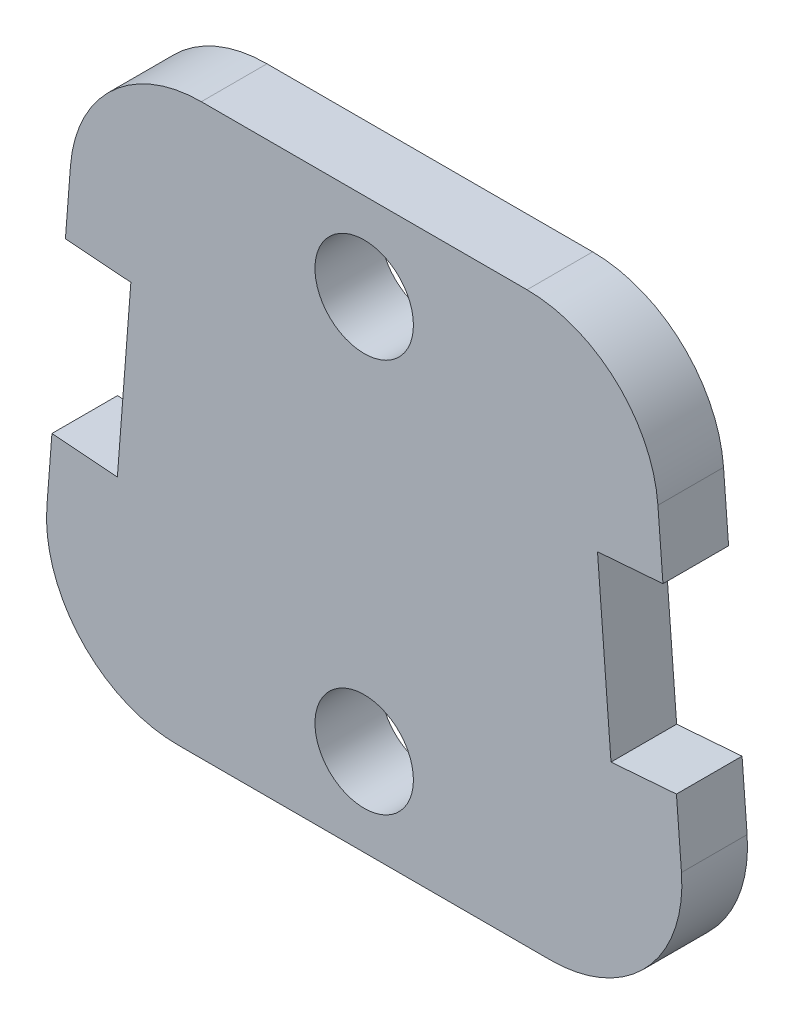
from build123d import *

# Parameters (mm, degrees)
BOSS_EXTRUDE1_DEPTH = 3.175
CAVITY1_DEPTH       = 3.175


# Read off the part's stored shape, not the designer's step: Cavity1
with BuildPart() as part:
    # Sketch1 → Boss-Extrude1 (new body)
    with BuildSketch(Plane.XY):
        with BuildLine():
            Line((-9.017779189, 0), (0, 0))
            Line((0, 0), (0, 1.852083291))
            ThreePointArc((0, 1.852083291), (-2.38125, 4.233333291), (0, 6.614583291))
            Line((0, 6.614583291), (0, 20.902083291))
            ThreePointArc((0, 20.902083291), (-2.38125, 23.283333291), (0, 25.664583291))
            Line((0, 25.664583291), (0, 27.516666667))
            Line((0, 27.516666667), (-7.878035599, 27.516666667))
            ThreePointArc((-7.878035599, 27.516666667), (-12.19254052, 25.825802562), (-14.209331582, 21.653689435))
            Line((-14.209331582, 21.653689435), (-15.349075172, 6.837022768))
            ThreePointArc((-15.349075172, 6.837022768), (-13.676915084, 2.035495079), (-9.017779189, 0))
        make_face()
        with BuildLine():
            Line((0, 1.852083291), (0, 0))
            Line((0, 0), (9.017779189, 0))
            ThreePointArc((9.017779189, 0), (13.676915084, 2.035495079), (15.349075172, 6.837022768))
            Line((15.349075172, 6.837022768), (14.209331582, 21.653689435))
            ThreePointArc((14.209331582, 21.653689435), (12.19254052, 25.825802562), (7.878035599, 27.516666667))
            Line((7.878035599, 27.516666667), (0, 27.516666667))
            Line((0, 27.516666667), (0, 25.664583291))
            ThreePointArc((0, 25.664583291), (1.683798023, 24.967131314), (2.38125, 23.283333291))
            ThreePointArc((2.38125, 23.283333291), (1.683798023, 21.599535268), (0, 20.902083291))
            Line((0, 20.902083291), (0, 6.614583291))
            ThreePointArc((0, 6.614583291), (1.683798023, 5.917131314), (2.38125, 4.233333291))
            ThreePointArc((2.38125, 4.233333291), (1.683798023, 2.549535268), (0, 1.852083291))
        make_face()
    extrude(amount=BOSS_EXTRUDE1_DEPTH)

    # Cavity1 outline → Cavity1 (cut)
    with BuildSketch(Plane.XY):
        Polygon((11.287194974, 18.244530059), (11.939915796, 9.759159375), (15.105563788, 10.002670759), (14.452842966, 18.488041443), align=None)
        Polygon((-15.105563788, 10.002670759), (-11.939915796, 9.759159375), (-11.287194974, 18.244530059), (-14.452842966, 18.488041443), align=None)
    extrude(amount=CAVITY1_DEPTH, mode=Mode.SUBTRACT)


solid = part.part
